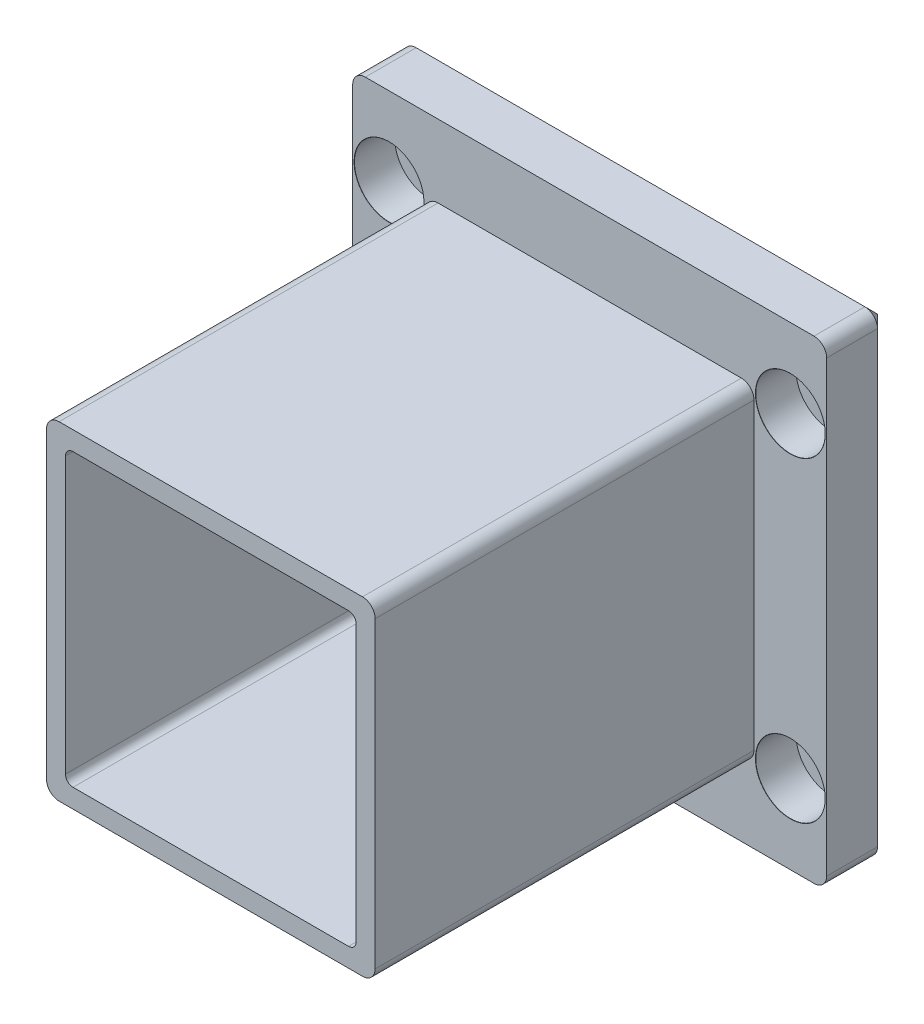
from build123d import *

# Parameters (mm, degrees)
SKETCH1_W                                    = 46
SKETCH1_H                                    = 46
BOSS_EXTRUDE1_DEPTH                          = 65
SKETCH3_W                                    = 75
SKETCH3_H                                    = 75
BOSS_EXTRUDE2_DEPTH                          = 5
SKETCH8_W                                    = 75
SKETCH8_H                                    = 75
SKETCH8_W_2                                  = 52
SKETCH8_H_2                                  = 52
BOSS_EXTRUDE3_DEPTH                          = 5.047079132
FILLET1_R                                    = 2
CBORE_FOR_M6_HEX_SOCKET_HEAD_CAP_SCR_2_COUNT = 2
CBORE_FOR_M6_HEX_SOCKET_HEAD_CAP_SCR_2_PITCH = 50
CBORE_FOR_M6_HEX_SOCKET_HEAD_CAP_SCR_3_COUNT = 2
CBORE_FOR_M6_HEX_SOCKET_HEAD_CAP_SCR_3_PITCH = 63.5
CBORE_FOR_M6_HEX_SOCKET_HEAD_CAP_SCR_4_COUNT = 2
CBORE_FOR_M6_HEX_SOCKET_HEAD_CAP_SCR_4_PITCH = 80.822336022
CHAMFER2_SIZE                                = 2
FILLET2_R                                    = 1.2


with BuildPart() as part:
    # Sketch1 → Boss-Extrude1 (new body)
    with BuildSketch(Plane(origin=(0, 0, 0), x_dir=(0, 1, 0), z_dir=(0, 0, 1))):
        Polygon((-26.156583063, 30.146094376), (-29.048003873, 30.146094376), (-29.048003873, -21.853905624), (22.951996127, -21.853905624), (22.951996127, 30.146094376), (15.339697873, 30.146094376), align=None)
        with Locations((-3.048003873, 4.146094376)):
            Rectangle(SKETCH1_W, SKETCH1_H, mode=Mode.SUBTRACT)
    extrude(amount=BOSS_EXTRUDE1_DEPTH)

    # Sketch3 → Boss-Extrude2 (add)
    with BuildSketch(Plane(origin=(0, 0, 0), x_dir=(1, 0, 0), z_dir=(0, 0, -1))):
        with Locations((-4.146094376, 3.048003873)):
            Rectangle(SKETCH3_W, SKETCH3_H)
    extrude(amount=BOSS_EXTRUDE2_DEPTH)

    # Sketch8 → Boss-Extrude3 (add)
    with BuildSketch(Plane.XY):
        with Locations((-4.146094376, -3.048003873)):
            Rectangle(SKETCH8_W, SKETCH8_H)
        with Locations((-4.146094376, -3.048003873)):
            Rectangle(SKETCH8_W_2, SKETCH8_H_2, mode=Mode.SUBTRACT)
    extrude(amount=BOSS_EXTRUDE3_DEPTH)

    # Fillet1
    fillet1_edges = [part.edges().sort_by_distance(p)[0] for p in [
        (21.853905624, -29.048003873, 35.023539566),
        (-30.146094376, -29.048003873, 35.023539566),
        (-30.146094376, 22.951996127, 35.023539566),
        (21.853905624, 22.951996127, 35.023539566),
        (33.353905624, 34.451996127, 0.023539566),
        (-41.646094376, 34.451996127, 0.023539566),
        (-41.646094376, -40.548003873, 0.023539566),
        (33.353905624, -40.548003873, 0.023539566),
    ]]
    fillet(fillet1_edges, radius=FILLET1_R)

    # Sketch15 → CBORE for M6 Hex Socket Head Cap Screw2 (revolve, cut)
    with BuildSketch(Plane(origin=(-35.896094376, 21.951996127, 5.047079132), x_dir=(0, -1, 0), z_dir=(1, 0, 0))):
        Polygon((0, 0), (0, 10.047079132), (3.3, 10.047079132), (3.3, 6.4), (5.5, 6.4), (5.5, 0.025), (5.525, 0), align=None)
    cbore_for_m6_hex_socket_head_cap_screw2 = revolve(axis=Axis((-35.896094376, 21.951996127, 11.397079132), (0, 0, -1)), mode=Mode.SUBTRACT)

    # CBORE for M6 Hex Socket Head Cap Scr 2: CBORE for M6 Hex Socket Head Cap Screw2 ×2
    with Locations(*[(0, -i * CBORE_FOR_M6_HEX_SOCKET_HEAD_CAP_SCR_2_PITCH, 0) for i in range(1, CBORE_FOR_M6_HEX_SOCKET_HEAD_CAP_SCR_2_COUNT)]):
        add(cbore_for_m6_hex_socket_head_cap_screw2, mode=Mode.SUBTRACT)

    # CBORE for M6 Hex Socket Head Cap Scr 3: CBORE for M6 Hex Socket Head Cap Screw2 ×2
    with Locations(*[(i * CBORE_FOR_M6_HEX_SOCKET_HEAD_CAP_SCR_3_PITCH, 0, 0) for i in range(1, CBORE_FOR_M6_HEX_SOCKET_HEAD_CAP_SCR_3_COUNT)]):
        add(cbore_for_m6_hex_socket_head_cap_screw2, mode=Mode.SUBTRACT)

    # CBORE for M6 Hex Socket Head Cap Scr 4: CBORE for M6 Hex Socket Head Cap Screw2 ×2
    with Locations(*[Vector(0.7856739006278309, -0.6186408666360874, 0) * (i * CBORE_FOR_M6_HEX_SOCKET_HEAD_CAP_SCR_4_PITCH) for i in range(1, CBORE_FOR_M6_HEX_SOCKET_HEAD_CAP_SCR_4_COUNT)]):
        add(cbore_for_m6_hex_socket_head_cap_screw2, mode=Mode.SUBTRACT)

    # Chamfer2
    chamfer2_edges = [part.edges().sort_by_distance(p)[0] for p in [
        (-41.646094376, -3.048003873, -5),
        (-4.146094376, -40.548003873, -5),
        (33.353905624, -3.048003873, -5),
        (-41.060307938, -39.962217436, -5),
        (32.768119187, -39.962217436, -5),
        (-41.060307938, 33.866209689, -5),
        (32.768119187, 33.866209689, -5),
        (-4.146094376, 34.451996127, -5),
    ]]
    chamfer(chamfer2_edges, length=CHAMFER2_SIZE)

    # Fillet2
    fillet2_edges = [part.edges().sort_by_distance(p)[0] for p in [
        (18.853905624, 19.951996127, 32.5),
        (-27.146094376, 19.951996127, 32.5),
        (-27.146094376, -26.048003873, 32.5),
        (18.853905624, -26.048003873, 32.5),
    ]]
    fillet(fillet2_edges, radius=FILLET2_R)


solid = part.part
